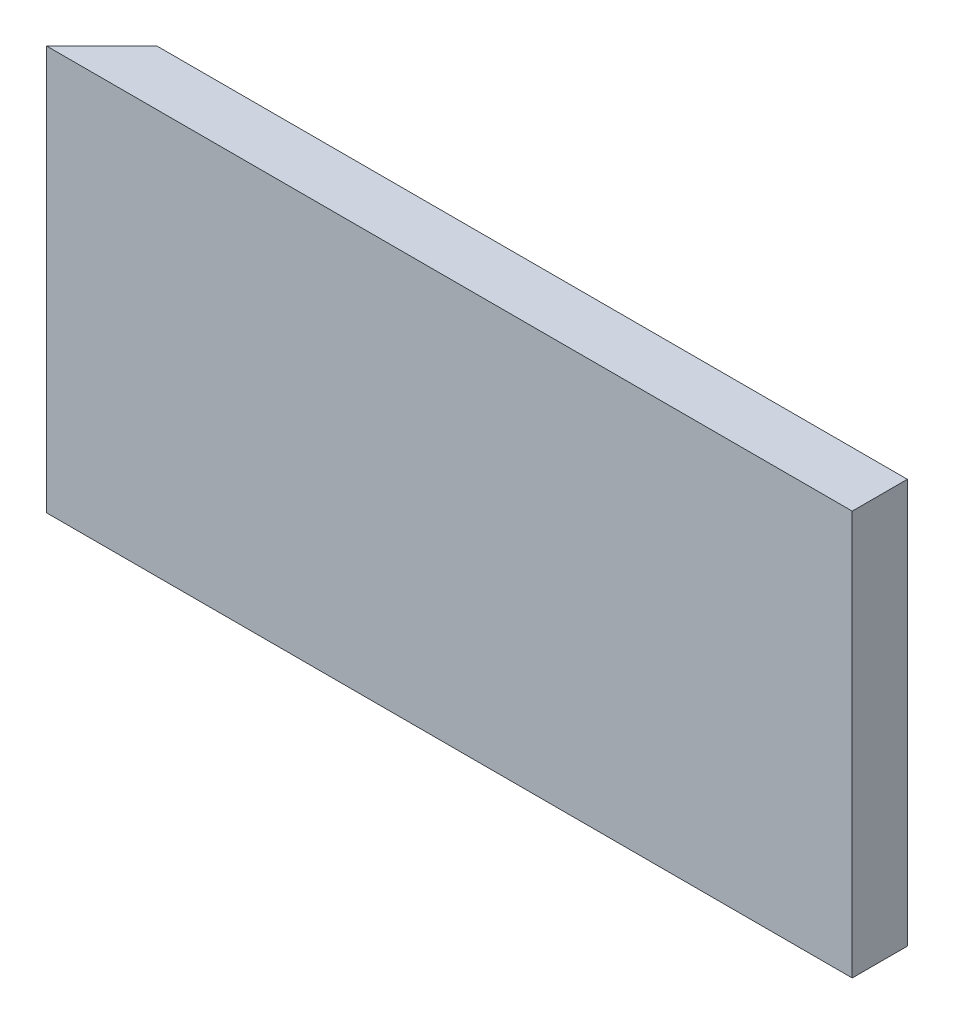
from build123d import *

# Parameters (mm, degrees)
SKETCH1_W           = 263
SKETCH1_H           = 132
BOSS_EXTRUDE1_DEPTH = 18
CHAMFER1_START      = -1
CHAMFER1_OUTLINE_W  = 28
CHAMFER1_OUTLINE_H  = 134
CHAMFER1_DEPTH      = 13.727922061


with BuildPart() as part:
    # Sketch1 → Boss-Extrude1 (new body)
    with BuildSketch(Plane.XY):
        with Locations((131.5, 66)):
            Rectangle(SKETCH1_W, SKETCH1_H)
    extrude(amount=BOSS_EXTRUDE1_DEPTH)

    # Chamfer1: read off the stored shape, not the designer's step
    # Chamfer1 outline → Chamfer1 (cut)
    with BuildSketch(Plane(origin=(0, 0, 0), x_dir=(0.7071067811865474, 0, -0.7071067811865477), z_dir=(0.7071067811865476, 0, 0.7071067811865476)).offset(CHAMFER1_START)):
        with Locations((0, 66)):
            Rectangle(CHAMFER1_OUTLINE_W, CHAMFER1_OUTLINE_H)
    extrude(amount=CHAMFER1_DEPTH, mode=Mode.SUBTRACT)


solid = part.part
